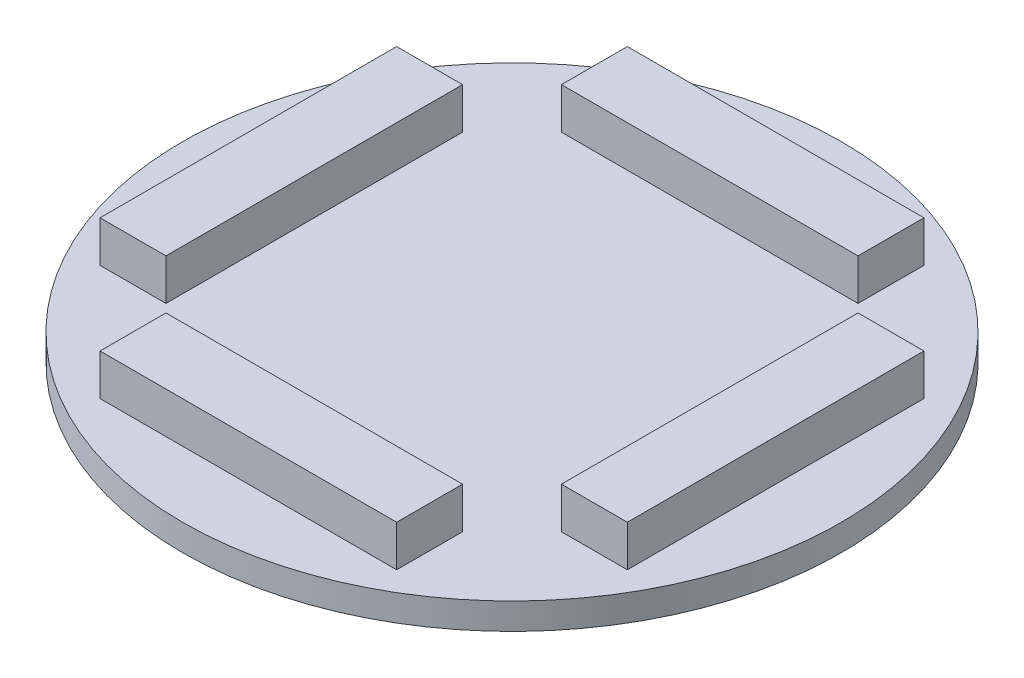
from build123d import *

# Parameters (mm, degrees)
SKETCH1_R                    = 20
PCB_DEPTH                    = 1.6
SKETCH2_W                    = 18
SKETCH2_H                    = 4
HIROSE_CONNECTOR_STACK_DEPTH = 2.5
CIRPATTERN1_COUNT            = 4


with BuildPart() as part:
    # Sketch1 → PCB (new body)
    with BuildSketch(Plane(origin=(0, 0, 0), x_dir=(1, 0, 0), z_dir=(0, 1, 0))):
        Circle(SKETCH1_R)
    extrude(amount=PCB_DEPTH)

    # Sketch2 → Hirose Connector Stack (add)
    with BuildSketch(Plane(origin=(0, 1.6, 0), x_dir=(1, 0, 0), z_dir=(0, 1, 0))):
        with Locations((0, 14)):
            Rectangle(SKETCH2_W, SKETCH2_H)
    hirose_connector_stack = extrude(amount=HIROSE_CONNECTOR_STACK_DEPTH)

    # CirPattern1: Hirose Connector Stack ×4 about axis
    cirpattern1_axis = Axis((0, 1.6, 0), (0, 1, 0))
    for i in range(1, CIRPATTERN1_COUNT):
        add(hirose_connector_stack.rotate(cirpattern1_axis, i * 360 / CIRPATTERN1_COUNT))


solid = part.part
